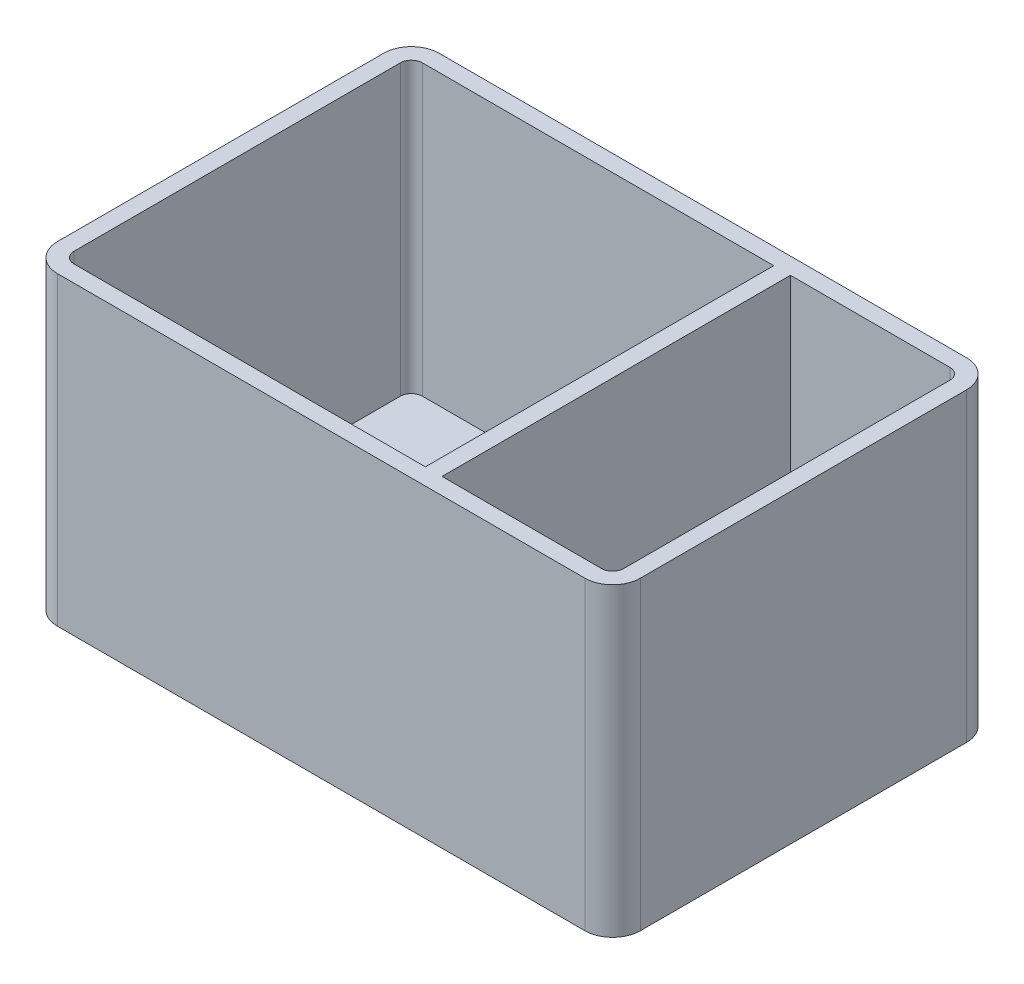
from build123d import *

# Parameters (mm, degrees)
BOSS_EXTRUDE1_DEPTH                     = 55
SHELL1_T                                = -3
CUT_EXTRUDE1_DEPTH                      = 2
BATTERY_CONNECTOR_SKETCH_3_R            = 2.15
CUT_EXTRUDE2_DEPTH                      = 3
BATTERY_CONNECTOR_SKETCH_4_R            = 2.15
CUT_EXTRUDE3_DEPTH                      = 3
BOSS_EXTRUDE6_START                     = 12.75
BOSS_EXTRUDE6_DEPTH                     = 12.75
CONNECTOR_SIDE_MOUNT_SKETCH_R           = 1.55
CONNECTOR_SIDE_MOUNT_SKETCH_R_2         = 1.505
CONNECTOR_MOUNT_PINS_SOCKETS_DEPTH      = 2.4
CONNECTOR_MOUNT_PINS_SOCKETS_SKETCH_3_W = 24.3
CONNECTOR_MOUNT_PINS_SOCKETS_SKETCH_3_H = 1.2
BOSS_EXTRUDE7_DEPTH                     = 0.7
PARTITION_SKETCH_W                      = 3
PARTITION_SKETCH_H                      = 62.75
PARTITION_BOSS_DEPTH                    = 52
SKETCH28_R                              = 3.5
CUT_EXTRUDE4_DEPTH                      = 3


with BuildPart() as part:
    # Sketch2 → Boss-Extrude1 (new body)
    with BuildSketch(Plane(origin=(0, 0, 0), x_dir=(1, 0, 0), z_dir=(0, 1, 0))):
        with BuildLine():
            Line((47.5, -34.375), (-47.5, -34.375))
            ThreePointArc((-47.5, -34.375), (-51.035533906, -32.910533906), (-52.5, -29.375))
            Line((-52.5, -29.375), (-52.5, 29.375))
            ThreePointArc((-52.5, 29.375), (-51.035533906, 32.910533906), (-47.5, 34.375))
            Line((-47.5, 34.375), (47.5, 34.375))
            ThreePointArc((47.5, 34.375), (51.035533906, 32.910533906), (52.5, 29.375))
            Line((52.5, 29.375), (52.5, -29.375))
            ThreePointArc((52.5, -29.375), (51.035533906, -32.910533906), (47.5, -34.375))
        make_face()
    extrude(amount=BOSS_EXTRUDE1_DEPTH)

    # Shell1
    shell1_openings = [part.faces().sort_by_distance(p)[0] for p in [
        (0, 55, 0),
    ]]
    offset(amount=SHELL1_T, openings=shell1_openings, kind=Kind.INTERSECTION)

    # battery_connector_sketch → Cut-Extrude1 (cut)
    with BuildSketch(Plane(origin=(0, 3, 0), x_dir=(1, 0, 0), z_dir=(0, 1, 0))):
        with BuildLine():
            Line((-48.255414742, -4.831437415), (-48.255414742, -29.131437415))
            ThreePointArc((-48.255414742, -29.131437415), (-47.669628305, -30.545650977), (-46.255414742, -31.131437415))
            Line((-46.255414742, -31.131437415), (-40.255414742, -31.131437415))
            ThreePointArc((-40.255414742, -31.131437415), (-38.84120118, -30.545650977), (-38.255414742, -29.131437415))
            Line((-38.255414742, -29.131437415), (-38.255414742, -21.901437415))
            Line((-38.255414742, -21.901437415), (-39.505414742, -20.561437415))
            Line((-39.505414742, -20.561437415), (-39.505414742, -13.401437415))
            Line((-39.505414742, -13.401437415), (-38.255414742, -12.061437415))
            Line((-38.255414742, -12.061437415), (-38.255414742, -4.831437415))
            ThreePointArc((-38.255414742, -4.831437415), (-38.84120118, -3.417223852), (-40.255414742, -2.831437415))
            Line((-40.255414742, -2.831437415), (-46.255414742, -2.831437415))
            ThreePointArc((-46.255414742, -2.831437415), (-47.669628305, -3.417223852), (-48.255414742, -4.831437415))
        make_face()
    extrude(amount=-CUT_EXTRUDE1_DEPTH, mode=Mode.SUBTRACT)

    # battery_connector_sketch<3> → Cut-Extrude2 (cut)
    with BuildSketch(Plane(origin=(0, 3, 0), x_dir=(1, 0, 0), z_dir=(0, 1, 0))):
        with Locations((-43.255414742, -6.881437415)):
            Circle(BATTERY_CONNECTOR_SKETCH_3_R)
    extrude(amount=-CUT_EXTRUDE2_DEPTH, mode=Mode.SUBTRACT)

    # battery_connector_sketch<4> → Cut-Extrude3 (cut)
    with BuildSketch(Plane(origin=(0, 3, 0), x_dir=(1, 0, 0), z_dir=(0, 1, 0))):
        with Locations((-43.255414742, -24.831437415)):
            Circle(BATTERY_CONNECTOR_SKETCH_4_R)
    extrude(amount=-CUT_EXTRUDE3_DEPTH, mode=Mode.SUBTRACT)

    # Sketch25 → Boss-Extrude6 (add)
    with BuildSketch(Plane(origin=(0, 3, 0), x_dir=(1, 0, 0), z_dir=(0, 1, 0)).offset(BOSS_EXTRUDE6_START)):
        with BuildLine():
            Line((-46.255414742, -31.131437415), (-48.456518483, -31.131437415))
            ThreePointArc((-48.456518483, -31.131437415), (-49.21945296, -30.396509431), (-49.5, -29.375))
            Line((-49.5, -29.375), (-49.5, -2.831437415))
            Line((-49.5, -2.831437415), (-46.255414742, -2.831437415))
            ThreePointArc((-46.255414742, -2.831437415), (-47.669628305, -3.417223852), (-48.255414742, -4.831437415))
            Line((-48.255414742, -4.831437415), (-48.255414742, -29.131437415))
            ThreePointArc((-48.255414742, -29.131437415), (-47.669628305, -30.545650977), (-46.255414742, -31.131437415))
        make_face()
    extrude(amount=-BOSS_EXTRUDE6_DEPTH)

    # connector_side_mount_sketch → connector_mount_pins_sockets (cut)
    with BuildSketch(Plane(origin=(-48.255414742, 0, 0), x_dir=(0, 0, -1), z_dir=(1, 0, 0))):
        with Locations((-9.891437415, 11.25)):
            Circle(CONNECTOR_SIDE_MOUNT_SKETCH_R)
        with Locations((-24.071437415, 11.25)):
            Circle(CONNECTOR_SIDE_MOUNT_SKETCH_R_2)
    extrude(amount=-CONNECTOR_MOUNT_PINS_SOCKETS_DEPTH, mode=Mode.SUBTRACT)

    # connector_mount_pins_sockets_sketch<3> → Boss-Extrude7 (add)
    with BuildSketch(Plane(origin=(-48.255414742, 0, 0), x_dir=(0, 0, -1), z_dir=(1, 0, 0))):
        with Locations((-16.981437415, 6.6)):
            Rectangle(CONNECTOR_MOUNT_PINS_SOCKETS_SKETCH_3_W, CONNECTOR_MOUNT_PINS_SOCKETS_SKETCH_3_H)
    extrude(amount=BOSS_EXTRUDE7_DEPTH)

    # partition-sketch → partition-boss (add)
    with BuildSketch(Plane(origin=(0, 3, 0), x_dir=(1, 0, 0), z_dir=(0, 1, 0))):
        with Locations((17.270599113, 0)):
            Rectangle(PARTITION_SKETCH_W, PARTITION_SKETCH_H)
    extrude(amount=PARTITION_BOSS_DEPTH)

    # Sketch28 → Cut-Extrude4 (cut)
    with BuildSketch(Plane(origin=(18.770599113, 0, 0), x_dir=(0, 0, -1), z_dir=(1, 0, 0))):
        with Locations((26.075, 6.6)):
            Circle(SKETCH28_R)
    extrude(amount=-CUT_EXTRUDE4_DEPTH, mode=Mode.SUBTRACT)


solid = part.part
